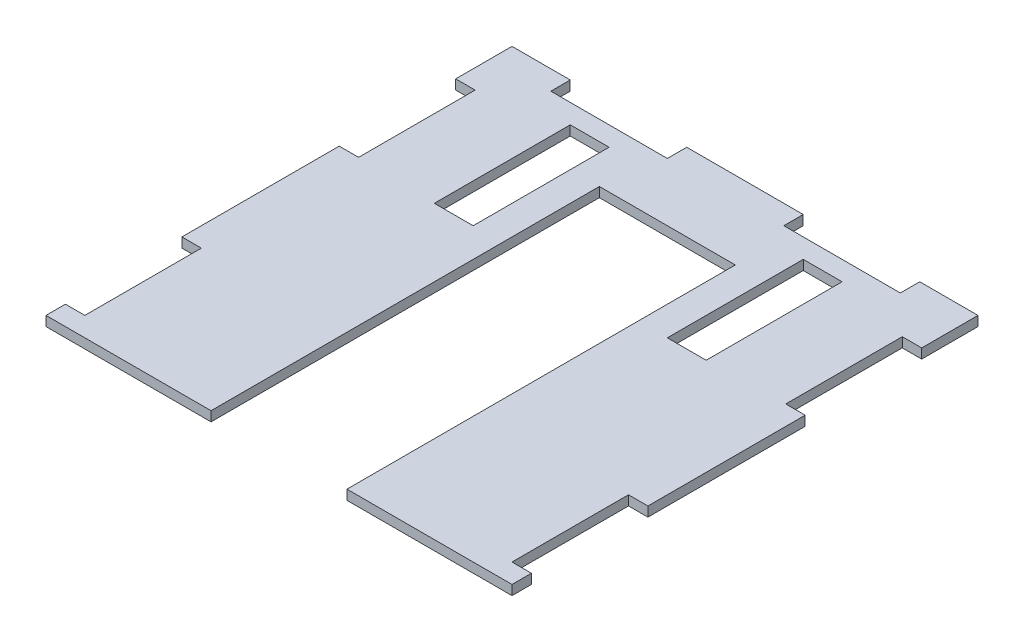
from build123d import *

# Parameters (mm, degrees)
BOSS_EXTRUDE1_DEPTH = 6.35
SKETCH2_W           = 12.7
SKETCH2_H           = 76.2
SKETCH2_W_2         = 76.2
SKETCH2_H_2         = 12.7
SKETCH2_W_3         = 25.4
SKETCH2_H_3         = 88.9
CUT_EXTRUDE1_DEPTH  = 319.324429631


with BuildPart() as part:
    # Sketch1 → Boss-Extrude1 (new body)
    with BuildSketch(Plane(origin=(0, 0, 0), x_dir=(1, 0, 0), z_dir=(0, 1, 0))):
        Polygon((-152.4, 25.4), (-152.4, -279.4), (-44.45, -279.4), (-44.45, -25.4), (44.45, -25.4), (44.45, -279.4), (152.4, -279.4), (152.4, 25.4), align=None)
    extrude(amount=BOSS_EXTRUDE1_DEPTH)

    # Sketch2 → Cut-Extrude1 (cut, through all)
    with BuildSketch(Plane(origin=(0, 6.35, 0), x_dir=(1, 0, 0), z_dir=(0, 1, 0))):
        with Locations((146.05, -49.53)):
            Rectangle(SKETCH2_W, SKETCH2_H)
        with Locations((146.05, -228.6)):
            Rectangle(SKETCH2_W, SKETCH2_H)
        with Locations((-146.05, -228.6)):
            Rectangle(SKETCH2_W, SKETCH2_H)
        with Locations((-146.05, -49.53)):
            Rectangle(SKETCH2_W, SKETCH2_H)
        with Locations((-76.2, 19.05)):
            Rectangle(SKETCH2_W_2, SKETCH2_H_2)
        with Locations((76.2, 19.05)):
            Rectangle(SKETCH2_W_2, SKETCH2_H_2)
        with Locations((-76.2, -44.45)):
            Rectangle(SKETCH2_W_3, SKETCH2_H_3)
        with Locations((76.2, -44.45)):
            Rectangle(SKETCH2_W_3, SKETCH2_H_3)
    extrude(amount=-CUT_EXTRUDE1_DEPTH, mode=Mode.SUBTRACT)


solid = part.part
